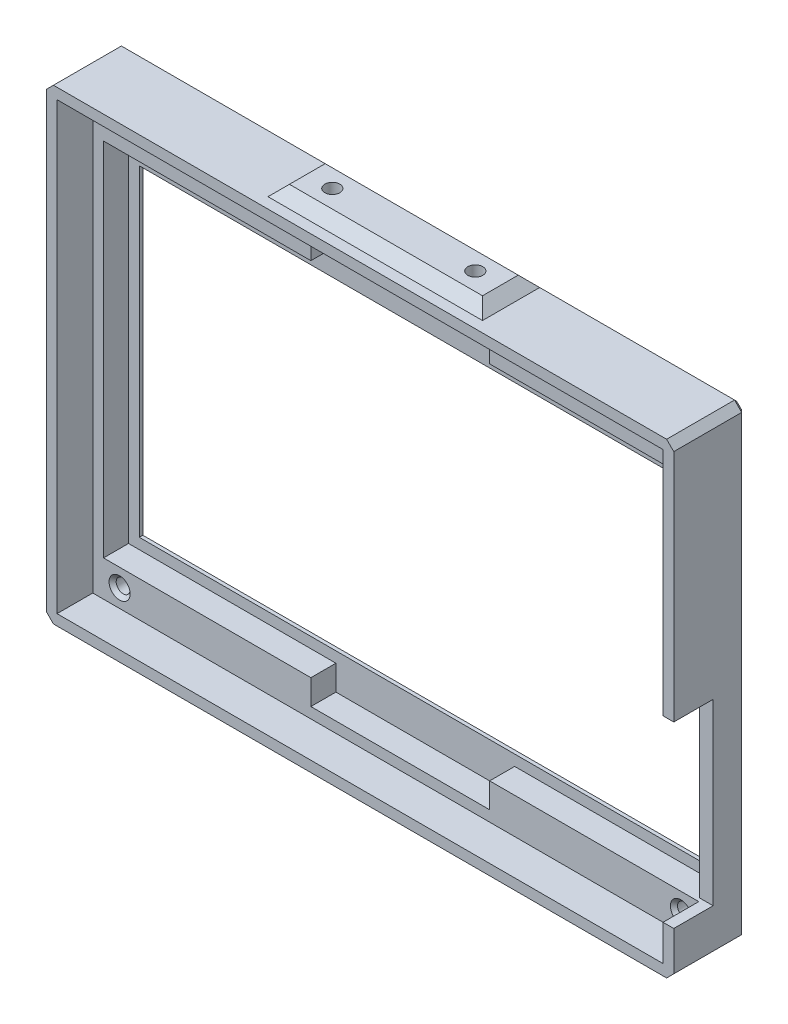
from build123d import *

# Parameters (mm, degrees)
CROQUIS1_W              = 218
CROQUIS1_H              = 145
SALIENTE_EXTRUIR1_DEPTH = 10
CORTAR_EXTRUIR1_DEPTH   = 7
CROQUIS3_W              = 157.5
CROQUIS3_H              = 90
CORTAR_EXTRUIR2_DEPTH   = 132.096338622
CHAFL_N1_SIZE           = 2
CORTAR_EXTRUIR3_START   = -2
CROQUIS4_R              = 1.95
CORTAR_EXTRUIR3_DEPTH   = 130.290707973
CROQUIS5_W              = 50
CROQUIS5_H              = 12
CORTAR_EXTRUIR4_DEPTH   = 7
CHAFL_N3_SIZE           = 1
CROQUIS6_OUTSIDE_W      = 272.402
CROQUIS6_OUTSIDE_H      = 199.402
CROQUIS6_OUTSIDE_W_2    = 175.5
CROQUIS6_OUTSIDE_H_2    = 130.5
CORTAR_EXTRUIR5_DEPTH   = 132.290707973
CROQUIS7_W              = 175.5
CROQUIS7_H              = 130.5
CROQUIS7_W_2            = 169.5
CROQUIS7_H_2            = 124.5
SALIENTE_EXTRUIR2_DEPTH = 10
CHAFL_N4_SIZE           = 2
CHAFL_N5_SIZE           = 1
CORTAR_EXTRUIR6_REACH   = 190.564
CROQUIS8_W              = 11
CROQUIS8_H              = 50
CROQUIS9_W              = 60
CROQUIS9_H              = 16
SALIENTE_EXTRUIR3_DEPTH = 3
CHAFL_N6_SIZE           = 3
CORTAR_EXTRUIR7_REACH   = 163.689
CROQUIS10_R             = 2.1
CORTAR_EXTRUIR8_REACH   = 166.689
CORTAR_EXTRUIR8_START   = -3


with BuildPart() as part:
    # Croquis1 → Saliente-Extruir1 (new body)
    with BuildSketch(Plane.XY):
        Rectangle(CROQUIS1_W, CROQUIS1_H)
    extrude(amount=SALIENTE_EXTRUIR1_DEPTH)

    # Croquis2 → Cortar-Extruir1 (cut)
    with BuildSketch(Plane.XY.offset(10)):
        Polygon((-83, 43), (-83, 48), (82.7, 48), (82.7, -53), (80.5, -53), (-83, -53), align=None)
    extrude(amount=-CORTAR_EXTRUIR1_DEPTH, mode=Mode.SUBTRACT)

    # Croquis3 → Cortar-Extruir2 (cut, through all)
    with BuildSketch(Plane.XY.offset(3)):
        with Locations((-1.25, -5)):
            Rectangle(CROQUIS3_W, CROQUIS3_H)
    extrude(amount=-CORTAR_EXTRUIR2_DEPTH, mode=Mode.SUBTRACT)

    # Chaflán1
    chafl_n1_edges = [part.edges().sort_by_distance(p)[0] for p in [
        (-80, -5, 0),
        (-1.25, 40, 0),
        (77.5, -5, 0),
        (-1.25, -50, 0),
    ]]
    chamfer(chafl_n1_edges, length=CHAFL_N1_SIZE)

    # Croquis4 → Cortar-Extruir3 (cut, through all)
    with BuildSketch(Plane(origin=(0, 0, 0), x_dir=(-1, 0, 0), z_dir=(0, 0, -1)).offset(CORTAR_EXTRUIR3_START)):
        with Locations((-78.5, 56.5)):
            Circle(CROQUIS4_R)
        with Locations((78.5, 56.5)):
            Circle(CROQUIS4_R)
        with Locations((78.5, -58)):
            Circle(CROQUIS4_R)
        with Locations((-78.5, -58)):
            Circle(CROQUIS4_R)
    extrude(amount=-CORTAR_EXTRUIR3_DEPTH, mode=Mode.SUBTRACT)

    # Croquis5 → Cortar-Extruir4 (cut)
    with BuildSketch(Plane.XY.offset(10)):
        with Locations((0, 54)):
            Rectangle(CROQUIS5_W, CROQUIS5_H)
        with Locations((0, -54)):
            Rectangle(CROQUIS5_W, CROQUIS5_H)
    extrude(amount=-CORTAR_EXTRUIR4_DEPTH, mode=Mode.SUBTRACT)

    # Chaflán3
    chafl_n3_edges = [part.edges().sort_by_distance(p)[0] for p in [
        (80.45, -58, 10),
        (-76.55, -58, 10),
        (-76.55, 56.5, 10),
        (80.45, 56.5, 10),
    ]]
    chamfer(chafl_n3_edges, length=CHAFL_N3_SIZE)

    # Croquis6 outside → Cortar-Extruir5 (cut, through all)
    with BuildSketch(Plane.XY.offset(10)):
        Rectangle(CROQUIS6_OUTSIDE_W, CROQUIS6_OUTSIDE_H)
        with Locations((-1.25, -0.75)):
            Rectangle(CROQUIS6_OUTSIDE_W_2, CROQUIS6_OUTSIDE_H_2, mode=Mode.SUBTRACT)
    extrude(amount=-CORTAR_EXTRUIR5_DEPTH, mode=Mode.SUBTRACT)

    # Croquis7 → Saliente-Extruir2 (add)
    with BuildSketch(Plane.XY.offset(10)):
        with Locations((-1.25, -0.75)):
            Rectangle(CROQUIS7_W, CROQUIS7_H)
        with Locations((-1.25, -0.75)):
            Rectangle(CROQUIS7_W_2, CROQUIS7_H_2, mode=Mode.SUBTRACT)
    extrude(amount=SALIENTE_EXTRUIR2_DEPTH)

    # Chaflán4
    chafl_n4_edges = [part.edges().sort_by_distance(p)[0] for p in [
        (-89, 64.5, 10),
        (86.5, 64.5, 10),
        (86.5, -66, 10),
        (-89, -66, 10),
    ]]
    chamfer(chafl_n4_edges, length=CHAFL_N4_SIZE)

    # Chaflán5
    chafl_n5_edges = [part.edges().sort_by_distance(p)[0] for p in [
        (86.5, -0.75, 0),
        (-1.25, 64.5, 0),
        (-89, -0.75, 0),
        (-1.25, -66, 0),
        (-88, 63.5, 0),
        (-88, -65, 0),
        (85.5, -65, 0),
        (85.5, 63.5, 0),
    ]]
    chamfer(chafl_n5_edges, length=CHAFL_N5_SIZE)

    # Croquis8 → Cortar-Extruir6 (cut, up to next)
    with BuildSketch(Plane(origin=(86.5, 0, 0), x_dir=(0, 0, -1), z_dir=(1, 0, 0)), mode=Mode.PRIVATE) as cortar_extruir6_sk1:
        with Locations((-14.5, -28)):
            Rectangle(CROQUIS8_W, CROQUIS8_H)
    cortar_extruir6_tool1 = extrude(cortar_extruir6_sk1.sketch, amount=-CORTAR_EXTRUIR6_REACH, mode=Mode.PRIVATE) & part.part
    add(cortar_extruir6_tool1.solids().sort_by_distance((86.5, -28, 14.5))[0], mode=Mode.SUBTRACT)

    # Croquis9 → Saliente-Extruir3 (add)
    with BuildSketch(Plane(origin=(0, 64.5, 0), x_dir=(1, 0, 0), z_dir=(0, 1, 0))):
        with Locations((0, -9)):
            Rectangle(CROQUIS9_W, CROQUIS9_H)
    extrude(amount=SALIENTE_EXTRUIR3_DEPTH)

    # Chaflán6
    chafl_n6_edges = [part.edges().sort_by_distance(p)[0] for p in [
        (0, 67.5, 17),
        (-30, 67.5, 9),
        (0, 67.5, 1),
        (30, 67.5, 9),
    ]]
    chamfer(chafl_n6_edges, length=CHAFL_N6_SIZE - 0.0001)  # a hair under: the kernel refuses the full size

    # Croquis10 → Cortar-Extruir7 (cut, up to next)
    with BuildSketch(Plane(origin=(0, 67.5, 0), x_dir=(1, 0, 0), z_dir=(0, 1, 0)), mode=Mode.PRIVATE) as cortar_extruir7_sk1:
        with Locations(Location((20, -9, 0), (0, 0, 270))):
            Circle(CROQUIS10_R)
    cortar_extruir7_tool1 = extrude(cortar_extruir7_sk1.sketch, amount=-CORTAR_EXTRUIR7_REACH, mode=Mode.PRIVATE) & part.part
    # Croquis10 → Cortar-Extruir7 (cut, up to next)
    with BuildSketch(Plane(origin=(0, 67.5, 0), x_dir=(1, 0, 0), z_dir=(0, 1, 0)), mode=Mode.PRIVATE) as cortar_extruir7_sk2:
        with Locations(Location((-20, -9, 0), (0, 0, 208.436890149))):
            Circle(CROQUIS10_R)
    cortar_extruir7_tool2 = extrude(cortar_extruir7_sk2.sketch, amount=-CORTAR_EXTRUIR7_REACH, mode=Mode.PRIVATE) & part.part
    add(cortar_extruir7_tool1.solids().sort_by_distance((20, 67.5, 9))[0], mode=Mode.SUBTRACT)
    add(cortar_extruir7_tool2.solids().sort_by_distance((-20, 67.5, 9))[0], mode=Mode.SUBTRACT)

    # Croquis11 → Cortar-Extruir8 (cut, up to next)
    with BuildSketch(Plane(origin=(0, 67.5, 0), x_dir=(1, 0, 0), z_dir=(0, 1, 0)).offset(CORTAR_EXTRUIR8_START), mode=Mode.PRIVATE) as cortar_extruir8_sk1:
        Polygon((23.983716857, -9), (21.991858429, -5.55), (18.008141571, -5.55), (16.016283143, -9), (18.008141571, -12.45), (21.991858429, -12.45), align=None)
    cortar_extruir8_tool1 = extrude(cortar_extruir8_sk1.sketch, amount=-CORTAR_EXTRUIR8_REACH, mode=Mode.PRIVATE) & part.part
    # Croquis11 → Cortar-Extruir8 (cut, up to next)
    with BuildSketch(Plane(origin=(0, 67.5, 0), x_dir=(1, 0, 0), z_dir=(0, 1, 0)).offset(CORTAR_EXTRUIR8_START), mode=Mode.PRIVATE) as cortar_extruir8_sk2:
        Polygon((-16.016283143, -9), (-18.008141571, -5.55), (-21.991858429, -5.55), (-23.983716857, -9), (-21.991858429, -12.45), (-18.008141571, -12.45), align=None)
    cortar_extruir8_tool2 = extrude(cortar_extruir8_sk2.sketch, amount=-CORTAR_EXTRUIR8_REACH, mode=Mode.PRIVATE) & part.part
    add(cortar_extruir8_tool1.solids().sort_by_distance((20, 64.5, 9))[0], mode=Mode.SUBTRACT)
    add(cortar_extruir8_tool2.solids().sort_by_distance((-20, 64.5, 9))[0], mode=Mode.SUBTRACT)


solid = part.part
